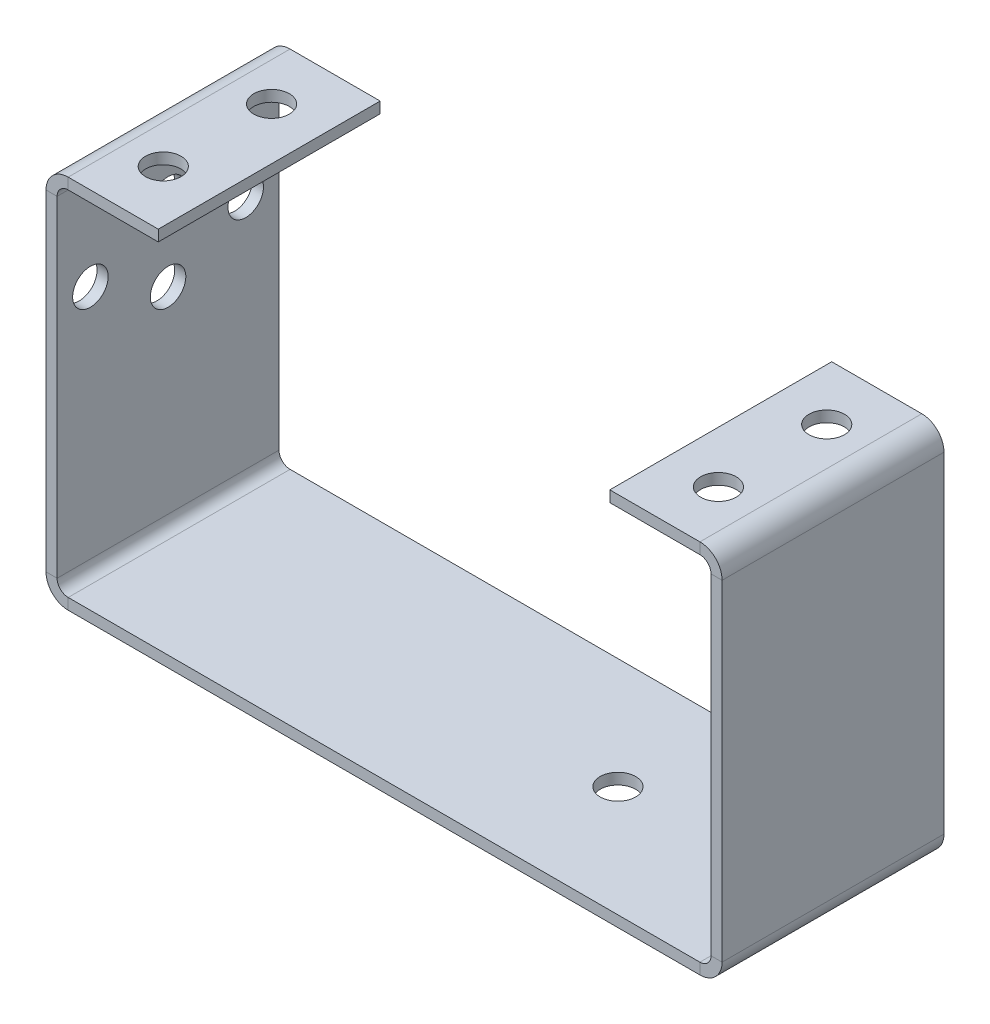
from build123d import *

# Parameters (mm, degrees)
SKETCH_2_W                = 60.94
SKETCH_2_H                = 20
EXTRUDE_1_DEPTH           = 1
SKETCH_3_W                = 1
SKETCH_3_H                = 20
EXTRUDE_2_DEPTH           = 32.81
SKETCH_4_W                = 1
SKETCH_4_H                = 20
EXTRUDE_3_DEPTH           = 32.81
SKETCH_9_W                = 20
SKETCH_9_H                = 1
EXTRUDE_8_DEPTH           = 9.12
SKETCH_10_W               = 20
SKETCH_10_H               = 1
EXTRUDE_9_DEPTH           = 9.12
SKETCH_13_R               = 1.6
CUT_EXTRUDE_2_DEPTH       = 1
SKETCH_14_R               = 1.6
CUT_EXTRUDE_3_DEPTH       = 1
SKETCH_15_R               = 1.6
CUT_EXTRUDE_4_DEPTH       = 1
SKETCH_16_R               = 1.6
CUT_EXTRUDE_5_DEPTH       = 1
SKETCH_17_R               = 1.6
CUT_EXTRUDE_6_DEPTH       = 1
SKETCH_19_R               = 1.6
CUT_EXTRUDE_7_DEPTH       = 1
SKETCH_20_R               = 1.6
CUT_EXTRUDE_8_DEPTH       = 1
SKETCH_22_R               = 1.6
CUT_EXTRUDE_9_DEPTH       = 1
SKETCH_23_R               = 1.6
CUT_EXTRUDE_10_DEPTH      = 1
SHEET_START               = 1
SHEET_METAL_1_OUTLINE_W   = 10.12
SHEET_METAL_1_OUTLINE_H   = 20
SHEET_METAL_1_OUTLINE_R   = 1.6
SHEET_METAL_1_DEPTH       = 32.81
SHEET_METAL_1_2_OUTLINE_W = 40.64238898
SHEET_METAL_1_2_OUTLINE_H = 20
SHEET_METAL_1_2_OUTLINE_R = 1.6
SHEET_METAL_1_2_DEPTH     = 1
SHEET_START_2             = -20
SHEET_METAL_1_3_DEPTH     = 20
SHEET_METAL_1_3_2_DEPTH   = 20


with BuildPart() as part:
    # Sketch 2 → ﾎﾞｽ - 押し出し1 (new body)
    with BuildSketch(Plane(origin=(0, 0, 0), x_dir=(1, 0, 0), z_dir=(0, 1, 0))):
        with Locations((30.47, 10)):
            Rectangle(SKETCH_2_W, SKETCH_2_H)
    extrude(amount=EXTRUDE_1_DEPTH)

    # ｽｹｯﾁ3 → ﾎﾞｽ - 押し出し2 (add)
    with BuildSketch(Plane(origin=(0, 1, 0), x_dir=(1, 0, 0), z_dir=(0, 1, 0))):
        with Locations((60.44, 10)):
            Rectangle(SKETCH_3_W, SKETCH_3_H)
    extrude(amount=EXTRUDE_2_DEPTH)

    # ｽｹｯﾁ4 → ﾎﾞｽ - 押し出し3 (add)
    with BuildSketch(Plane(origin=(0, 1, 0), x_dir=(1, 0, 0), z_dir=(0, 1, 0))):
        with Locations((0.5, 10)):
            Rectangle(SKETCH_4_W, SKETCH_4_H)
    extrude(amount=EXTRUDE_3_DEPTH)

    # ｽｹｯﾁ9 → ﾎﾞｽ - 押し出し8 (add)
    with BuildSketch(Plane.ZY.offset(-59.94)):
        with Locations((-10, 33.31)):
            Rectangle(SKETCH_9_W, SKETCH_9_H)
    extrude(amount=EXTRUDE_8_DEPTH)

    # ｽｹｯﾁ10 → ﾎﾞｽ - 押し出し9 (add)
    with BuildSketch(Plane(origin=(1, 0, 0), x_dir=(0, 0, -1), z_dir=(1, 0, 0))):
        with Locations((10, 33.31)):
            Rectangle(SKETCH_10_W, SKETCH_10_H)
    extrude(amount=EXTRUDE_9_DEPTH)

    # ｽｹｯﾁ13 → ｶｯﾄ - 押し出し2 (cut)
    with BuildSketch(Plane(origin=(0, 33.81, 0), x_dir=(1, 0, 0), z_dir=(0, 1, 0))):
        with Locations(Location((55.49, 5.12, 0), (0, 0, 270))):
            Circle(SKETCH_13_R)
    extrude(amount=-CUT_EXTRUDE_2_DEPTH, mode=Mode.SUBTRACT)

    # ｽｹｯﾁ14 → ｶｯﾄ - 押し出し3 (cut)
    with BuildSketch(Plane(origin=(0, 33.81, 0), x_dir=(1, 0, 0), z_dir=(0, 1, 0))):
        with Locations(Location((55.49, 14.88, 0), (0, 0, 270))):
            Circle(SKETCH_14_R)
    extrude(amount=-CUT_EXTRUDE_3_DEPTH, mode=Mode.SUBTRACT)

    # ｽｹｯﾁ15 → ｶｯﾄ - 押し出し4 (cut)
    with BuildSketch(Plane(origin=(0, 33.81, 0), x_dir=(1, 0, 0), z_dir=(0, 1, 0))):
        with Locations(Location((5.45, 5.12, 0), (0, 0, 270))):
            Circle(SKETCH_15_R)
    extrude(amount=-CUT_EXTRUDE_4_DEPTH, mode=Mode.SUBTRACT)

    # ｽｹｯﾁ16 → ｶｯﾄ - 押し出し5 (cut)
    with BuildSketch(Plane(origin=(0, 33.81, 0), x_dir=(1, 0, 0), z_dir=(0, 1, 0))):
        with Locations(Location((5.45, 14.88, 0), (0, 0, 270))):
            Circle(SKETCH_16_R)
    extrude(amount=-CUT_EXTRUDE_5_DEPTH, mode=Mode.SUBTRACT)

    # ｽｹｯﾁ17 → ｶｯﾄ - 押し出し6 (cut)
    with BuildSketch(Plane(origin=(0, 0, 0), x_dir=(-1, 0, 0), z_dir=(0, -1, 0))):
        with Locations(Location((-41.55, 10, 0), (0, 0, 90))):
            Circle(SKETCH_17_R)
    extrude(amount=-CUT_EXTRUDE_6_DEPTH, mode=Mode.SUBTRACT)

    # ｽｹｯﾁ19 → ｶｯﾄ - 押し出し7 (cut)
    with BuildSketch(Plane.ZY):
        with Locations((-3, 23.25)):
            Circle(SKETCH_19_R)
    extrude(amount=-CUT_EXTRUDE_7_DEPTH, mode=Mode.SUBTRACT)

    # ｽｹｯﾁ20 → ｶｯﾄ - 押し出し8 (cut)
    with BuildSketch(Plane.ZY):
        with Locations((-17, 23.25)):
            Circle(SKETCH_20_R)
    extrude(amount=-CUT_EXTRUDE_8_DEPTH, mode=Mode.SUBTRACT)

    # ｽｹｯﾁ22 → ｶｯﾄ - 押し出し9 (cut)
    with BuildSketch(Plane.ZY):
        with Locations((-10, 19.75)):
            Circle(SKETCH_22_R)
    extrude(amount=-CUT_EXTRUDE_9_DEPTH, mode=Mode.SUBTRACT)

    # ｽｹｯﾁ23 → ｶｯﾄ - 押し出し10 (cut)
    with BuildSketch(Plane.ZY):
        with Locations((-10, 26.75)):
            Circle(SKETCH_23_R)
    extrude(amount=-CUT_EXTRUDE_10_DEPTH, mode=Mode.SUBTRACT)

    # Sheet Metal 1: read off the stored shape, not the designer's step
    # Sheet Metal 1 outline → Sheet Metal 1 (cut)
    # profile 1 of 2: a face of its own
    with BuildSketch(Plane(origin=(0, 0, 0), x_dir=(1, 0, 0), z_dir=(0, 1, 0)).offset(SHEET_START)):
        with Locations((55.88, 10)):
            Rectangle(SHEET_METAL_1_OUTLINE_W, SHEET_METAL_1_OUTLINE_H)
        with Locations((55.49, 14.88)):
            Circle(SHEET_METAL_1_OUTLINE_R, mode=Mode.SUBTRACT)
        with Locations((55.49, 5.12)):
            Circle(SHEET_METAL_1_OUTLINE_R, mode=Mode.SUBTRACT)
    # profile 2 of 2: a face of its own
    with BuildSketch(Plane(origin=(0, 0, 0), x_dir=(1, 0, 0), z_dir=(0, 1, 0)).offset(SHEET_START)):
        with Locations((5.06, 10)):
            Rectangle(SHEET_METAL_1_OUTLINE_W, SHEET_METAL_1_OUTLINE_H)
        with Locations((5.45, 5.12)):
            Circle(SHEET_METAL_1_OUTLINE_R, mode=Mode.SUBTRACT)
        with Locations((5.45, 14.88)):
            Circle(SHEET_METAL_1_OUTLINE_R, mode=Mode.SUBTRACT)
    extrude(amount=SHEET_METAL_1_DEPTH, mode=Mode.SUBTRACT)

    # Sheet Metal 1 2 outline → Sheet Metal 1 2 (add)
    # profile 1 of 2: a face of its own
    with BuildSketch(Plane(origin=(0, 0, 0), x_dir=(1, 0, 0), z_dir=(0, 1, 0))):
        with Locations((81.26119449, 10)):
            Rectangle(SHEET_METAL_1_2_OUTLINE_W, SHEET_METAL_1_2_OUTLINE_H)
        with Locations((96.91238898, 5.12)):
            Circle(SHEET_METAL_1_2_OUTLINE_R, mode=Mode.SUBTRACT)
        with Locations((96.91238898, 14.88)):
            Circle(SHEET_METAL_1_2_OUTLINE_R, mode=Mode.SUBTRACT)
    # profile 2 of 2: a face of its own
    with BuildSketch(Plane(origin=(0, 0, 0), x_dir=(1, 0, 0), z_dir=(0, 1, 0))):
        with Locations((-20.32119449, 10)):
            Rectangle(SHEET_METAL_1_2_OUTLINE_W, SHEET_METAL_1_2_OUTLINE_H)
        with Locations((-21.60619449, 3)):
            Circle(SHEET_METAL_1_2_OUTLINE_R, mode=Mode.SUBTRACT)
        with Locations((-35.97238898, 5.12)):
            Circle(SHEET_METAL_1_2_OUTLINE_R, mode=Mode.SUBTRACT)
        with Locations((-25.10619449, 10)):
            Circle(SHEET_METAL_1_2_OUTLINE_R, mode=Mode.SUBTRACT)
        with Locations((-18.10619449, 10)):
            Circle(SHEET_METAL_1_2_OUTLINE_R, mode=Mode.SUBTRACT)
        with Locations((-35.97238898, 14.88)):
            Circle(SHEET_METAL_1_2_OUTLINE_R, mode=Mode.SUBTRACT)
        with Locations((-21.60619449, 17)):
            Circle(SHEET_METAL_1_2_OUTLINE_R, mode=Mode.SUBTRACT)
    extrude(amount=SHEET_METAL_1_2_DEPTH)

    # Sheet Metal 1 3: read off the stored shape, not the designer's step
    # Sheet Metal 1 3 outline → Sheet Metal 1 3 (cut)
    with BuildSketch(Plane.XY.offset(SHEET_START_2)):
        with BuildLine():
            ThreePointArc((2, 0), (1, 0.267949193), (0.267949193, 1))
            Line((0.267949193, 1), (-40.64238898, 1))
            Line((-40.64238898, 1), (-40.64238898, 0))
            Line((-40.64238898, 0), (2, 0))
        make_face()
        with BuildLine():
            Line((101.58238898, 1), (60.672050807, 1))
            ThreePointArc((60.672050807, 1), (59.94, 0.267949193), (58.94, 0))
            Line((58.94, 0), (101.58238898, 0))
            Line((101.58238898, 0), (101.58238898, 1))
        make_face()
    extrude(amount=SHEET_METAL_1_3_DEPTH, mode=Mode.SUBTRACT)

    # Sheet Metal 1 3 2 outline → Sheet Metal 1 3 2 (add)
    with BuildSketch(Plane.XY.offset(SHEET_START_2)):
        with BuildLine():
            Line((2, 32.81), (10.12, 32.81))
            Line((10.12, 32.81), (10.12, 33.81))
            Line((10.12, 33.81), (2, 33.81))
            ThreePointArc((2, 33.81), (0.585786438, 33.224213562), (0, 31.81))
            Line((0, 31.81), (0, 2))
            ThreePointArc((0, 2), (0.068148348, 1.48236191), (0.267949193, 1))
            Line((0.267949193, 1), (2, 1))
            ThreePointArc((2, 1), (1.292893219, 1.292893219), (1, 2))
            Line((1, 2), (1, 31.81))
            ThreePointArc((1, 31.81), (1.292893219, 32.517106781), (2, 32.81))
        make_face()
        with BuildLine():
            Line((58.94, 33.81), (50.82, 33.81))
            Line((50.82, 33.81), (50.82, 32.81))
            Line((50.82, 32.81), (58.94, 32.81))
            ThreePointArc((58.94, 32.81), (59.647106781, 32.517106781), (59.94, 31.81))
            Line((59.94, 31.81), (59.94, 2))
            ThreePointArc((59.94, 2), (59.647106781, 1.292893219), (58.94, 1))
            Line((58.94, 1), (60.672050807, 1))
            ThreePointArc((60.672050807, 1), (60.871851652, 1.48236191), (60.94, 2))
            Line((60.94, 2), (60.94, 31.81))
            ThreePointArc((60.94, 31.81), (60.354213562, 33.224213562), (58.94, 33.81))
        make_face()
    extrude(amount=SHEET_METAL_1_3_2_DEPTH)

    # Sheet Metal 1 3 3: loft between two sections, ruled curve by curve
    sheet_metal_1_3_3_from = [
        Edge.make_three_point_arc((5.45, 32.81, -3.52), (7.05, 32.81, -5.12), (5.45, 32.81, -6.72)),
        Edge.make_three_point_arc((5.45, 32.81, -6.72), (3.85, 32.81, -5.12), (5.45, 32.81, -3.52)),
    ]
    sheet_metal_1_3_3_to = [
        Edge.make_three_point_arc((5.45, 33.81, -3.52), (7.05, 33.81, -5.12), (5.45, 33.81, -6.72)),
        Edge.make_three_point_arc((5.45, 33.81, -6.72), (3.85, 33.81, -5.12), (5.45, 33.81, -3.52)),
    ]
    sheet_metal_1_3_3 = Solid(Shell([*[Face.make_surface_from_curves(sheet_metal_1_3_3_from[k], sheet_metal_1_3_3_to[k]) for k in range(2)], Face(Wire(sheet_metal_1_3_3_from)), Face(Wire(sheet_metal_1_3_3_to))]))
    add(sheet_metal_1_3_3, mode=Mode.SUBTRACT)

    # Sheet Metal 1 3 4: loft between two sections, ruled curve by curve
    sheet_metal_1_3_4_from = [
        Edge.make_three_point_arc((5.45, 32.81, -13.28), (7.05, 32.81, -14.88), (5.45, 32.81, -16.48)),
        Edge.make_three_point_arc((5.45, 32.81, -16.48), (3.85, 32.81, -14.88), (5.45, 32.81, -13.28)),
    ]
    sheet_metal_1_3_4_to = [
        Edge.make_three_point_arc((5.45, 33.81, -13.28), (7.05, 33.81, -14.88), (5.45, 33.81, -16.48)),
        Edge.make_three_point_arc((5.45, 33.81, -16.48), (3.85, 33.81, -14.88), (5.45, 33.81, -13.28)),
    ]
    sheet_metal_1_3_4 = Solid(Shell([*[Face.make_surface_from_curves(sheet_metal_1_3_4_from[k], sheet_metal_1_3_4_to[k]) for k in range(2)], Face(Wire(sheet_metal_1_3_4_from)), Face(Wire(sheet_metal_1_3_4_to))]))
    add(sheet_metal_1_3_4, mode=Mode.SUBTRACT)

    # Sheet Metal 1 3 5: loft between two sections, ruled curve by curve
    sheet_metal_1_3_5_from = [
        Edge.make_three_point_arc((55.49, 32.81, -3.52), (57.09, 32.81, -5.12), (55.49, 32.81, -6.72)),
        Edge.make_three_point_arc((55.49, 32.81, -6.72), (53.89, 32.81, -5.12), (55.49, 32.81, -3.52)),
    ]
    sheet_metal_1_3_5_to = [
        Edge.make_three_point_arc((55.49, 33.81, -3.52), (57.09, 33.81, -5.12), (55.49, 33.81, -6.72)),
        Edge.make_three_point_arc((55.49, 33.81, -6.72), (53.89, 33.81, -5.12), (55.49, 33.81, -3.52)),
    ]
    sheet_metal_1_3_5 = Solid(Shell([*[Face.make_surface_from_curves(sheet_metal_1_3_5_from[k], sheet_metal_1_3_5_to[k]) for k in range(2)], Face(Wire(sheet_metal_1_3_5_from)), Face(Wire(sheet_metal_1_3_5_to))]))
    add(sheet_metal_1_3_5, mode=Mode.SUBTRACT)

    # Sheet Metal 1 3 6: loft between two sections, ruled curve by curve
    sheet_metal_1_3_6_from = [
        Edge.make_three_point_arc((55.49, 32.81, -13.28), (57.09, 32.81, -14.88), (55.49, 32.81, -16.48)),
        Edge.make_three_point_arc((55.49, 32.81, -16.48), (53.89, 32.81, -14.88), (55.49, 32.81, -13.28)),
    ]
    sheet_metal_1_3_6_to = [
        Edge.make_three_point_arc((55.49, 33.81, -13.28), (57.09, 33.81, -14.88), (55.49, 33.81, -16.48)),
        Edge.make_three_point_arc((55.49, 33.81, -16.48), (53.89, 33.81, -14.88), (55.49, 33.81, -13.28)),
    ]
    sheet_metal_1_3_6 = Solid(Shell([*[Face.make_surface_from_curves(sheet_metal_1_3_6_from[k], sheet_metal_1_3_6_to[k]) for k in range(2)], Face(Wire(sheet_metal_1_3_6_from)), Face(Wire(sheet_metal_1_3_6_to))]))
    add(sheet_metal_1_3_6, mode=Mode.SUBTRACT)

    # Sheet Metal 1 3 7: loft between two sections, ruled curve by curve
    sheet_metal_1_3_7_from = [
        Edge.make_three_point_arc((1, 26.75, -8.4), (1, 28.35, -10), (1, 26.75, -11.6)),
        Edge.make_three_point_arc((1, 26.75, -11.6), (1, 25.15, -10), (1, 26.75, -8.4)),
    ]
    sheet_metal_1_3_7_to = [
        Edge.make_three_point_arc((0, 26.75, -8.4), (0, 28.35, -10), (0, 26.75, -11.6)),
        Edge.make_three_point_arc((0, 26.75, -11.6), (0, 25.15, -10), (0, 26.75, -8.4)),
    ]
    sheet_metal_1_3_7 = Solid(Shell([*[Face.make_surface_from_curves(sheet_metal_1_3_7_from[k], sheet_metal_1_3_7_to[k]) for k in range(2)], Face(Wire(sheet_metal_1_3_7_from)), Face(Wire(sheet_metal_1_3_7_to))]))
    add(sheet_metal_1_3_7, mode=Mode.SUBTRACT)

    # Sheet Metal 1 3 8: loft between two sections, ruled curve by curve
    sheet_metal_1_3_8_from = [
        Edge.make_three_point_arc((1, 19.75, -8.4), (1, 21.35, -10), (1, 19.75, -11.6)),
        Edge.make_three_point_arc((1, 19.75, -11.6), (1, 18.15, -10), (1, 19.75, -8.4)),
    ]
    sheet_metal_1_3_8_to = [
        Edge.make_three_point_arc((0, 19.75, -8.4), (0, 21.35, -10), (0, 19.75, -11.6)),
        Edge.make_three_point_arc((0, 19.75, -11.6), (0, 18.15, -10), (0, 19.75, -8.4)),
    ]
    sheet_metal_1_3_8 = Solid(Shell([*[Face.make_surface_from_curves(sheet_metal_1_3_8_from[k], sheet_metal_1_3_8_to[k]) for k in range(2)], Face(Wire(sheet_metal_1_3_8_from)), Face(Wire(sheet_metal_1_3_8_to))]))
    add(sheet_metal_1_3_8, mode=Mode.SUBTRACT)

    # Sheet Metal 1 3 9: loft between two sections, ruled curve by curve
    sheet_metal_1_3_9_from = [
        Edge.make_three_point_arc((1, 23.25, -15.4), (1, 24.85, -17), (1, 23.25, -18.6)),
        Edge.make_three_point_arc((1, 23.25, -18.6), (1, 21.65, -17), (1, 23.25, -15.4)),
    ]
    sheet_metal_1_3_9_to = [
        Edge.make_three_point_arc((0, 23.25, -15.4), (0, 24.85, -17), (0, 23.25, -18.6)),
        Edge.make_three_point_arc((0, 23.25, -18.6), (0, 21.65, -17), (0, 23.25, -15.4)),
    ]
    sheet_metal_1_3_9 = Solid(Shell([*[Face.make_surface_from_curves(sheet_metal_1_3_9_from[k], sheet_metal_1_3_9_to[k]) for k in range(2)], Face(Wire(sheet_metal_1_3_9_from)), Face(Wire(sheet_metal_1_3_9_to))]))
    add(sheet_metal_1_3_9, mode=Mode.SUBTRACT)

    # Sheet Metal 1 3 10: loft between two sections, ruled curve by curve
    sheet_metal_1_3_10_from = [
        Edge.make_three_point_arc((1, 23.25, -1.4), (1, 24.85, -3), (1, 23.25, -4.6)),
        Edge.make_three_point_arc((1, 23.25, -4.6), (1, 21.65, -3), (1, 23.25, -1.4)),
    ]
    sheet_metal_1_3_10_to = [
        Edge.make_three_point_arc((0, 23.25, -1.4), (0, 24.85, -3), (0, 23.25, -4.6)),
        Edge.make_three_point_arc((0, 23.25, -4.6), (0, 21.65, -3), (0, 23.25, -1.4)),
    ]
    sheet_metal_1_3_10 = Solid(Shell([*[Face.make_surface_from_curves(sheet_metal_1_3_10_from[k], sheet_metal_1_3_10_to[k]) for k in range(2)], Face(Wire(sheet_metal_1_3_10_from)), Face(Wire(sheet_metal_1_3_10_to))]))
    add(sheet_metal_1_3_10, mode=Mode.SUBTRACT)


solid = part.part
